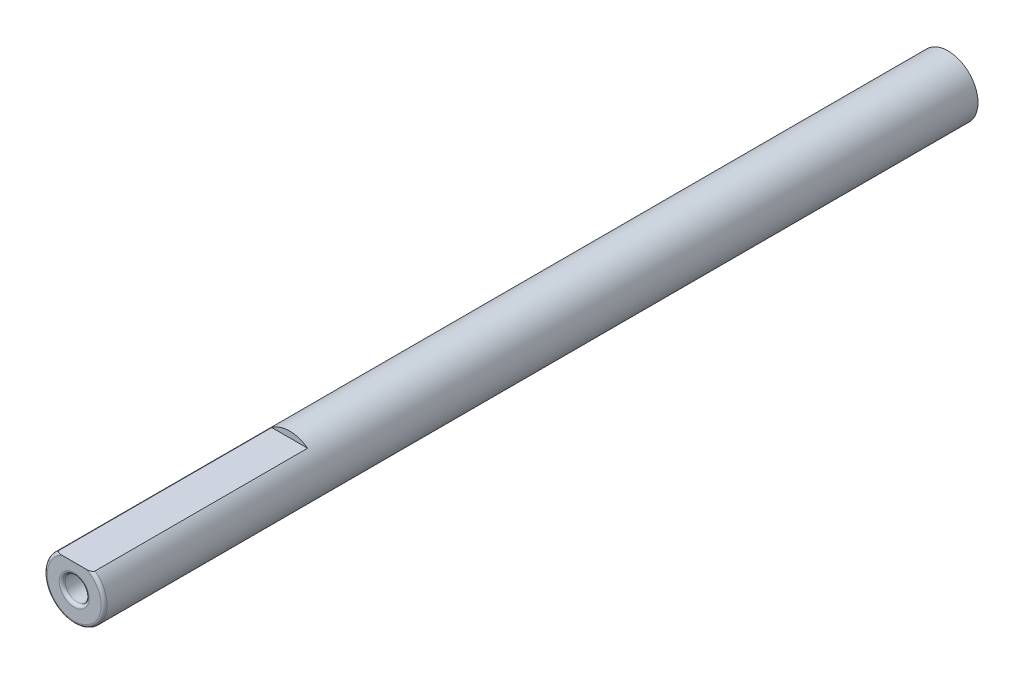
from build123d import *

# Parameters (mm, degrees)
SKETCH1_R          = 2.5
EXTRUDE1_DEPTH     = 73
SKETCH2_R          = 1
ICE1_DEPTH         = 10
FILLET1_R          = 0.25
CUT_EXTRUDE1_START = -18
CUT_EXTRUDE1_DEPTH = 18


with BuildPart() as part:
    # Sketch1 → Extrude1 (new body)
    with BuildSketch(Plane.XY):
        Circle(SKETCH1_R)
    extrude(amount=EXTRUDE1_DEPTH)

    # Sketch2 → ICE1 (cut)
    with BuildSketch(Plane.XY.offset(73)):
        Circle(SKETCH2_R)
    extrude(amount=-ICE1_DEPTH, mode=Mode.SUBTRACT)

    # Fillet1
    fillet1_edges = [part.edges().sort_by_distance(p)[0] for p in [
        (-2.5, 0, 73),
        (-1, 0, 73),
    ]]
    fillet(fillet1_edges, radius=FILLET1_R)

    # Sketch4 → Cut-Extrude1 (cut)
    with BuildSketch(Plane.XY.offset(73).offset(CUT_EXTRUDE1_START)):
        with BuildLine():
            Line((-1.5, 2), (1.5, 2))
            ThreePointArc((1.5, 2), (0, 2.5), (-1.5, 2))
        make_face()
    extrude(amount=CUT_EXTRUDE1_DEPTH, mode=Mode.SUBTRACT)


solid = part.part
